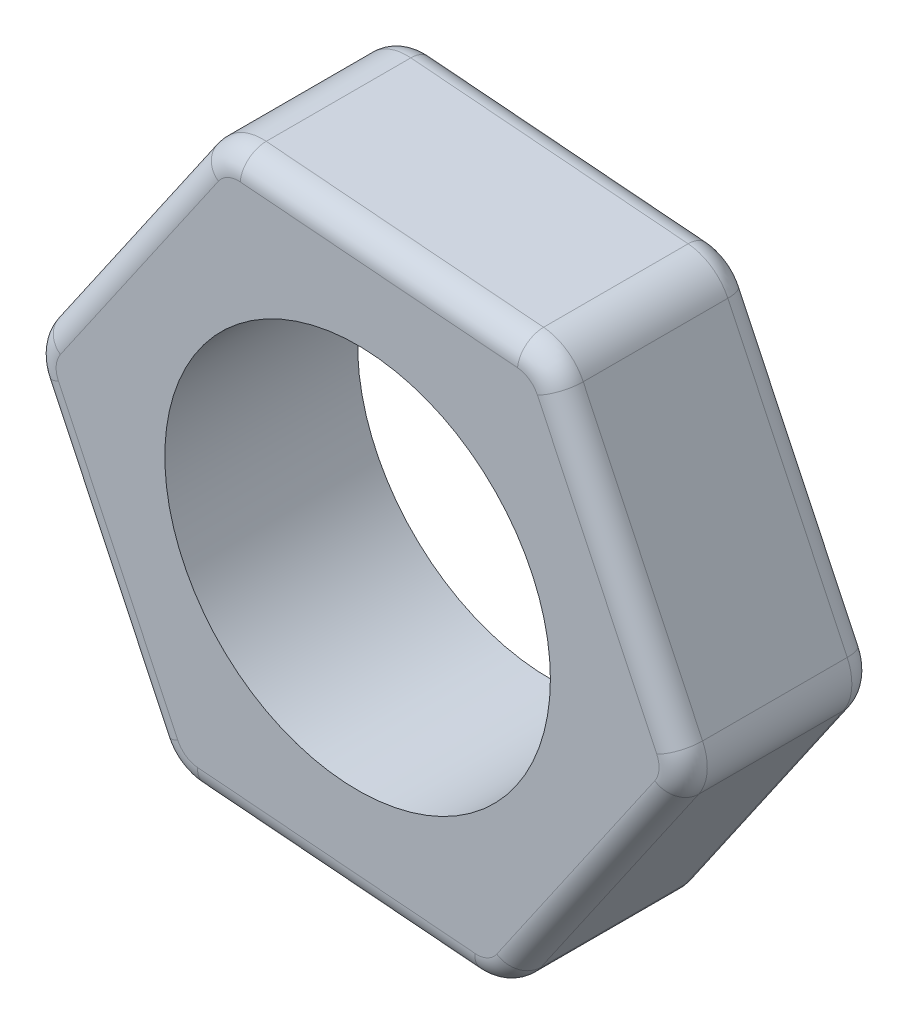
from build123d import *

# Parameters (mm, degrees)
SKETCH1_R           = 12.7
BOSS_EXTRUDE1_DEPTH = 6.35
FILLET1_R           = 1.5875
FILLET2_R           = 3.175


with BuildPart() as part:
    # Sketch1 → Boss-Extrude1 (new, symmetric)
    with BuildSketch(Plane.XY):
        Polygon((-9.43506227631135, 19.870822827505833), (-21.92616850087544, 1.7644077961790767), (-12.491106224564081, -18.10641503132676), (9.43506227631137, -19.870822827505812), (21.926168500875455, -1.764407796179048), (12.491106224564096, 18.10641503132678), align=None)
        Circle(SKETCH1_R, mode=Mode.SUBTRACT)
    extrude(amount=BOSS_EXTRUDE1_DEPTH, both=True)

    # Fillet1
    fillet1_edges = [part.edges().sort_by_distance(p)[0] for p in [
        (-17.208637362719763, -8.17100361757384, 6.35),
        (-1.5280219741263554, -18.988618929416283, 6.35),
        (15.680615388593413, -10.81761531184243, 6.35),
        (17.208637362719777, 8.171003617573865, 6.35),
        (1.5280219741263732, 18.988618929416305, 6.35),
        (17.208637362719777, 8.171003617573865, -6.35),
        (15.680615388593413, -10.81761531184243, -6.35),
        (-1.5280219741263554, -18.988618929416283, -6.35),
        (-17.208637362719763, -8.17100361757384, -6.35),
        (-15.680615388593395, 10.817615311842456, -6.35),
        (1.5280219741263732, 18.988618929416305, -6.35),
        (-15.680615388593395, 10.817615311842456, 6.35),
    ]]
    fillet(fillet1_edges, radius=FILLET1_R)

    # Fillet2
    # the kernel refuses this fillet: 3.175 mm, written as the material it takes off along each edge
    with BuildSketch(Plane(origin=(-7.862551896926124, 16.559019022921532, -6.35), x_dir=(-0.8231294167240627, 0.5678538221439602, 0), z_dir=(-0.5678538221439602, -0.8231294167240627, 0))) as fillet2_piece_1:
        with BuildLine():
            CenterArc((1.5875, -1.5875), 1.5875, 0, 90)
            Line((3.175, -1.5875), (3.175, 0))
            Line((3.175, 0), (1.5875, 0))
        make_face()
    revolve(axis=Axis((-7.862551896926124, 16.559019022921532, -6.35), (0, 0, -1)), revolution_arc=59.999999999999986, mode=Mode.SUBTRACT)
    with BuildSketch(Plane(origin=(10.409255187136749, 15.088679192772318, -6.35), x_dir=(0.08021112725072843, 0.996777896557286, 0), z_dir=(-0.996777896557286, 0.08021112725072843, 0))) as fillet2_piece_2:
        with BuildLine():
            CenterArc((1.5875, -1.5875), 1.5875, 0, 90)
            Line((3.175, -1.5875), (3.175, 0))
            Line((3.175, 0), (1.5875, 0))
        make_face()
    revolve(axis=Axis((10.409255187136749, 15.088679192772318, -6.35), (0, 0, -1)), revolution_arc=59.99999999999997, mode=Mode.SUBTRACT)
    with BuildSketch(Plane(origin=(-18.271807084062868, 1.470339830149234, -6.35), x_dir=(-0.9033405439747911, -0.4289240744133263, 0), z_dir=(0.4289240744133263, -0.9033405439747911, 0))) as fillet2_piece_3:
        with BuildLine():
            CenterArc((1.5875, -1.5875), 1.5875, 0, 90)
            Line((3.175, -1.5875), (3.175, 0))
            Line((3.175, 0), (1.5875, 0))
        make_face()
    revolve(axis=Axis((-18.271807084062868, 1.470339830149234, -6.35), (0, 0, -1)), revolution_arc=60.000000000000036, mode=Mode.SUBTRACT)
    with BuildSketch(Plane(origin=(18.27180708406288, -1.4703398301492088, -6.35), x_dir=(0.903340543974791, 0.4289240744133264, 0), z_dir=(-0.4289240744133264, 0.903340543974791, 0))) as fillet2_piece_4:
        with BuildLine():
            CenterArc((1.5875, -1.5875), 1.5875, 0, 90)
            Line((3.175, -1.5875), (3.175, 0))
            Line((3.175, 0), (1.5875, 0))
        make_face()
    revolve(axis=Axis((18.27180708406288, -1.4703398301492088, -6.35), (0, 0, -1)), revolution_arc=60.00000000000001, mode=Mode.SUBTRACT)
    with BuildSketch(Plane(origin=(-10.40925518713673, -15.0886791927723, -6.35), x_dir=(-0.0802111272507284, -0.996777896557286, 0), z_dir=(0.996777896557286, -0.0802111272507284, 0))) as fillet2_piece_5:
        with BuildLine():
            CenterArc((1.5875, -1.5875), 1.5875, 0, 90)
            Line((3.175, -1.5875), (3.175, 0))
            Line((3.175, 0), (1.5875, 0))
        make_face()
    revolve(axis=Axis((-10.40925518713673, -15.0886791927723, -6.35), (0, 0, -1)), revolution_arc=59.99999999999997, mode=Mode.SUBTRACT)
    with BuildSketch(Plane(origin=(7.862551896926148, -16.559019022921508, -6.35), x_dir=(0.823129416724063, -0.5678538221439597, 0), z_dir=(0.5678538221439597, 0.823129416724063, 0))) as fillet2_piece_6:
        with BuildLine():
            CenterArc((1.5875, -1.5875), 1.5875, 0, 90)
            Line((3.175, -1.5875), (3.175, 0))
            Line((3.175, 0), (1.5875, 0))
        make_face()
    revolve(axis=Axis((7.862551896926148, -16.559019022921508, -6.35), (0, 0, -1)), revolution_arc=60.00000000000002, mode=Mode.SUBTRACT)
    with BuildSketch(Plane(origin=(7.862551896926148, -16.559019022921508, 6.35), x_dir=(-0.0802111272507284, -0.996777896557286, 0), z_dir=(-0.996777896557286, 0.0802111272507284, 0))) as fillet2_piece_7:
        with BuildLine():
            CenterArc((1.5875, -1.5875), 1.5875, 0, 90)
            Line((3.175, -1.5875), (3.175, 0))
            Line((3.175, 0), (1.5875, 0))
        make_face()
    revolve(axis=Axis((7.862551896926148, -16.559019022921508, 6.35), (0, 0, 1)), revolution_arc=60.00000000000002, mode=Mode.SUBTRACT)
    with BuildSketch(Plane(origin=(-10.40925518713673, -15.0886791927723, 6.35), x_dir=(-0.9033405439747911, -0.4289240744133263, 0), z_dir=(-0.4289240744133263, 0.9033405439747911, 0))) as fillet2_piece_8:
        with BuildLine():
            CenterArc((1.5875, -1.5875), 1.5875, 0, 90)
            Line((3.175, -1.5875), (3.175, 0))
            Line((3.175, 0), (1.5875, 0))
        make_face()
    revolve(axis=Axis((-10.40925518713673, -15.0886791927723, 6.35), (0, 0, 1)), revolution_arc=59.99999999999997, mode=Mode.SUBTRACT)
    with BuildSketch(Plane(origin=(18.27180708406288, -1.4703398301492088, 6.35), x_dir=(0.823129416724063, -0.5678538221439597, 0), z_dir=(-0.5678538221439597, -0.823129416724063, 0))) as fillet2_piece_9:
        with BuildLine():
            CenterArc((1.5875, -1.5875), 1.5875, 0, 90)
            Line((3.175, -1.5875), (3.175, 0))
            Line((3.175, 0), (1.5875, 0))
        make_face()
    revolve(axis=Axis((18.27180708406288, -1.4703398301492088, 6.35), (0, 0, 1)), revolution_arc=60.00000000000001, mode=Mode.SUBTRACT)
    with BuildSketch(Plane(origin=(-18.271807084062868, 1.470339830149234, 6.35), x_dir=(-0.8231294167240627, 0.5678538221439602, 0), z_dir=(0.5678538221439602, 0.8231294167240627, 0))) as fillet2_piece_10:
        with BuildLine():
            CenterArc((1.5875, -1.5875), 1.5875, 0, 90)
            Line((3.175, -1.5875), (3.175, 0))
            Line((3.175, 0), (1.5875, 0))
        make_face()
    revolve(axis=Axis((-18.271807084062868, 1.470339830149234, 6.35), (0, 0, 1)), revolution_arc=60.000000000000036, mode=Mode.SUBTRACT)
    with BuildSketch(Plane(origin=(10.409255187136749, 15.088679192772318, 6.35), x_dir=(0.903340543974791, 0.4289240744133264, 0), z_dir=(0.4289240744133264, -0.903340543974791, 0))) as fillet2_piece_11:
        with BuildLine():
            CenterArc((1.5875, -1.5875), 1.5875, 0, 90)
            Line((3.175, -1.5875), (3.175, 0))
            Line((3.175, 0), (1.5875, 0))
        make_face()
    revolve(axis=Axis((10.409255187136749, 15.088679192772318, 6.35), (0, 0, 1)), revolution_arc=59.99999999999997, mode=Mode.SUBTRACT)
    with BuildSketch(Plane(origin=(-7.862551896926124, 16.559019022921532, 6.35), x_dir=(0.08021112725072843, 0.996777896557286, 0), z_dir=(0.996777896557286, -0.08021112725072843, 0))) as fillet2_piece_12:
        with BuildLine():
            CenterArc((1.5875, -1.5875), 1.5875, 0, 90)
            Line((3.175, -1.5875), (3.175, 0))
            Line((3.175, 0), (1.5875, 0))
        make_face()
    revolve(axis=Axis((-7.862551896926124, 16.559019022921532, 6.35), (0, 0, 1)), revolution_arc=59.999999999999986, mode=Mode.SUBTRACT)
    with BuildSketch(Plane(origin=(9.43506227631137, -19.870822827505812, -6.35), x_dir=(-0.9967778965572859, 0.08021112725072867, 0), z_dir=(0, 0, 1))) as fillet2_piece_13:
        with BuildLine():
            CenterArc((FILLET2_R * 0.57735026919, -FILLET2_R), FILLET2_R, 90.00000000000003, 60)
            Line((-FILLET2_R * 0.288675134595, -FILLET2_R * 0.5), (0, 0))
            Line((0, 0), (FILLET2_R * 0.57735026919, -3e-17))
        make_face()
    extrude(amount=12.7, mode=Mode.SUBTRACT)
    with BuildSketch(Plane(origin=(-12.491106224564081, -18.106415031326755, -6.35), x_dir=(-0.4289240744133256, 0.9033405439747914, 0), z_dir=(0, 0, 1))) as fillet2_piece_14:
        with BuildLine():
            CenterArc((FILLET2_R * 0.57735026919, -FILLET2_R), FILLET2_R, 90.00000000000006, 59.99999999999994)
            Line((-FILLET2_R * 0.288675134595, -FILLET2_R * 0.5), (0, 0))
            Line((0, 0), (FILLET2_R * 0.57735026919, -1.1e-16))
        make_face()
    extrude(amount=12.7, mode=Mode.SUBTRACT)
    with BuildSketch(Plane(origin=(-21.92616850087544, 1.764407796179075, -6.350000000000001), x_dir=(0.5678538221439581, 0.8231294167240641, 0), z_dir=(0, 0, 1))) as fillet2_piece_15:
        with BuildLine():
            CenterArc((FILLET2_R * 0.57735026919, -FILLET2_R), FILLET2_R, 89.99999999999986, 60.000000000000114)
            Line((-FILLET2_R * 0.288675134595, -FILLET2_R * 0.5), (0, 0))
            Line((0, 0), (FILLET2_R * 0.57735026919, 0))
        make_face()
    extrude(amount=12.700000000000001, mode=Mode.SUBTRACT)
    with BuildSketch(Plane(origin=(-9.43506227631135, 19.870822827505833, 6.35), x_dir=(-0.5678538221439603, -0.8231294167240626, 0), z_dir=(0, 0, -1))) as fillet2_piece_16:
        with BuildLine():
            CenterArc((FILLET2_R * 0.57735026919, -FILLET2_R), FILLET2_R, 89.99999999999997, 59.99999999999997)
            Line((-FILLET2_R * 0.288675134595, -FILLET2_R * 0.5), (0, 0))
            Line((0, 0), (FILLET2_R * 0.57735026919, 0))
        make_face()
    extrude(amount=12.7, mode=Mode.SUBTRACT)
    with BuildSketch(Plane(origin=(12.491106224564094, 18.10641503132678, 6.350000000000001), x_dir=(-0.9967778965572859, 0.0802111272507286, 0), z_dir=(0, 0, -1))) as fillet2_piece_17:
        with BuildLine():
            CenterArc((FILLET2_R * 0.57735026919, -FILLET2_R), FILLET2_R, 89.99999999999997, 59.99999999999994)
            Line((-FILLET2_R * 0.288675134595, -FILLET2_R * 0.5), (0, 0))
            Line((0, 0), (FILLET2_R * 0.57735026919, 0))
        make_face()
    extrude(amount=12.700000000000001, mode=Mode.SUBTRACT)
    with BuildSketch(Plane(origin=(21.926168500875455, -1.7644077961790465, 6.35), x_dir=(-0.42892407441332714, 0.9033405439747906, 0), z_dir=(0, 0, -1))) as fillet2_piece_18:
        with BuildLine():
            CenterArc((FILLET2_R * 0.57735026919, -FILLET2_R), FILLET2_R, 90.00000000000007, 59.999999999999986)
            Line((-FILLET2_R * 0.288675134595, -FILLET2_R * 0.5), (0, 0))
            Line((0, 0), (FILLET2_R * 0.57735026919, 0))
        make_face()
    extrude(amount=12.7, mode=Mode.SUBTRACT)


solid = part.part
